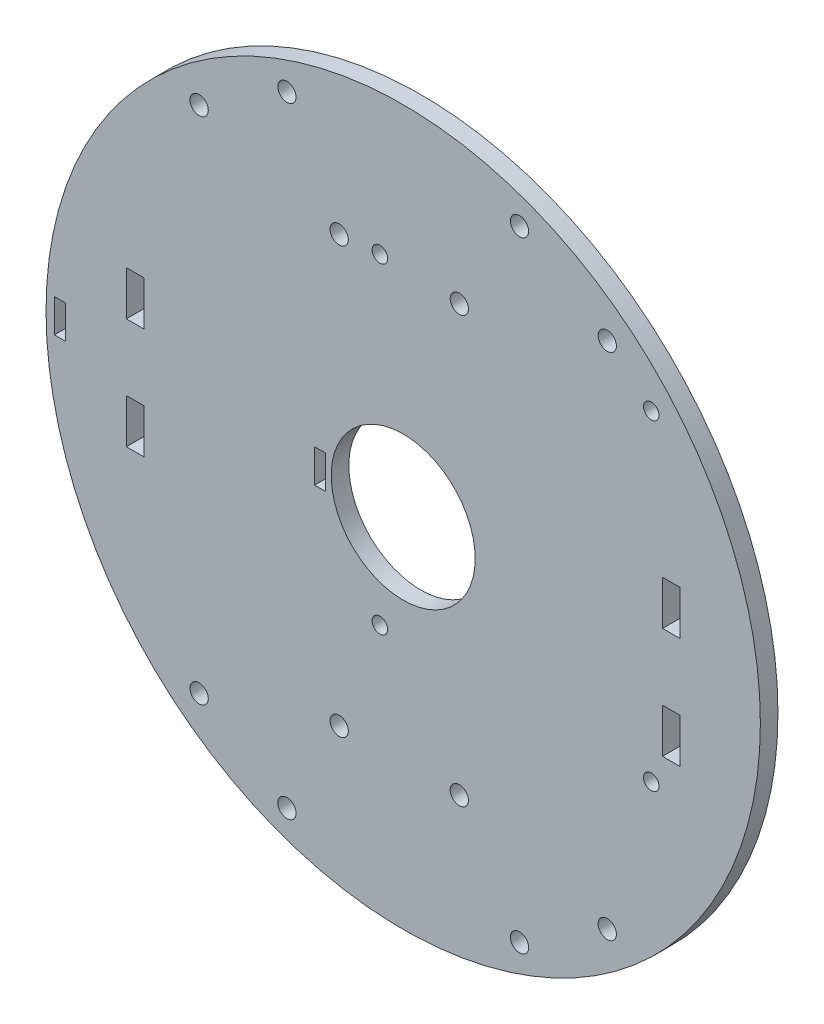
from build123d import *

# Parameters (mm, degrees)
SKETCH1_R           = 64.5
SKETCH1_R_2         = 1.65
SKETCH1_R_3         = 13
SKETCH1_R_4         = 1.4
SKETCH1_W           = 2
SKETCH1_H           = 6
BOSS_EXTRUDE2_DEPTH = 3.175
SKETCH2_W           = 3.175
SKETCH2_H           = 8
CUT_EXTRUDE1_DEPTH  = 103.233494915


with BuildPart() as part:
    # Sketch1 → Boss-Extrude2 (new body)
    with BuildSketch(Plane(origin=(0, 0, 0), x_dir=(-1, 0, 0), z_dir=(0, 0, 1))):
        with Locations((14.45539036, 0.366425758)):
            Circle(SKETCH1_R)
        with Locations((26.018596538, -38.058574242)):
            Circle(SKETCH1_R_2, mode=Mode.SUBTRACT)
        with Locations((4.318596538, -38.058574242)):
            Circle(SKETCH1_R_2, mode=Mode.SUBTRACT)
        with Locations((26.018596538, 38.791425758)):
            Circle(SKETCH1_R_2, mode=Mode.SUBTRACT)
        with Locations((4.318596538, 38.791425758)):
            Circle(SKETCH1_R_2, mode=Mode.SUBTRACT)
        with Locations((14.45539036, 0.366425758)):
            Circle(SKETCH1_R_3, mode=Mode.SUBTRACT)
        with Locations((-6.54460964, 56.366425758)):
            Circle(SKETCH1_R_2, mode=Mode.SUBTRACT)
        with Locations((-22.394874657, 46.366425758)):
            Circle(SKETCH1_R_2, mode=Mode.SUBTRACT)
        with Locations((35.45539036, 56.366425758)):
            Circle(SKETCH1_R_2, mode=Mode.SUBTRACT)
        with Locations((51.305655378, 46.366425758)):
            Circle(SKETCH1_R_2, mode=Mode.SUBTRACT)
        with Locations((51.305655378, -45.633574242)):
            Circle(SKETCH1_R_2, mode=Mode.SUBTRACT)
        with Locations((35.45539036, -55.633574242)):
            Circle(SKETCH1_R_2, mode=Mode.SUBTRACT)
        with Locations((-6.54460964, -55.633574242)):
            Circle(SKETCH1_R_2, mode=Mode.SUBTRACT)
        with Locations((-22.394874657, -45.633574242)):
            Circle(SKETCH1_R_2, mode=Mode.SUBTRACT)
        with Locations((18.66683861, -38.633574242)):
            Circle(SKETCH1_R_4, mode=Mode.SUBTRACT)
        with Locations((-30.33316139, -38.633574242)):
            Circle(SKETCH1_R_4, mode=Mode.SUBTRACT)
        with Locations((18.66683861, 19.366425758)):
            Circle(SKETCH1_R_4, mode=Mode.SUBTRACT)
        with Locations((-30.33316139, 19.366425758)):
            Circle(SKETCH1_R_4, mode=Mode.SUBTRACT)
        with Locations((29.45539036, 0.366425758)):
            Rectangle(SKETCH1_W, SKETCH1_H, mode=Mode.SUBTRACT)
        with Locations((76.45539036, 0.366425758)):
            Rectangle(SKETCH1_W, SKETCH1_H, mode=Mode.SUBTRACT)
    extrude(amount=BOSS_EXTRUDE2_DEPTH)

    # Sketch2 → Cut-Extrude1 (cut, through all)
    with BuildSketch(Plane.XY.offset(3.175)):
        with Locations((33.95710964, -10.366425758)):
            Rectangle(SKETCH2_W, SKETCH2_H)
        with Locations((33.95710964, 9.633574242)):
            Rectangle(SKETCH2_W, SKETCH2_H)
        with Locations((-62.86789036, 9.633574242)):
            Rectangle(SKETCH2_W, SKETCH2_H)
        with Locations((-62.86789036, -10.366425758)):
            Rectangle(SKETCH2_W, SKETCH2_H)
    extrude(amount=-CUT_EXTRUDE1_DEPTH, mode=Mode.SUBTRACT)


solid = part.part
